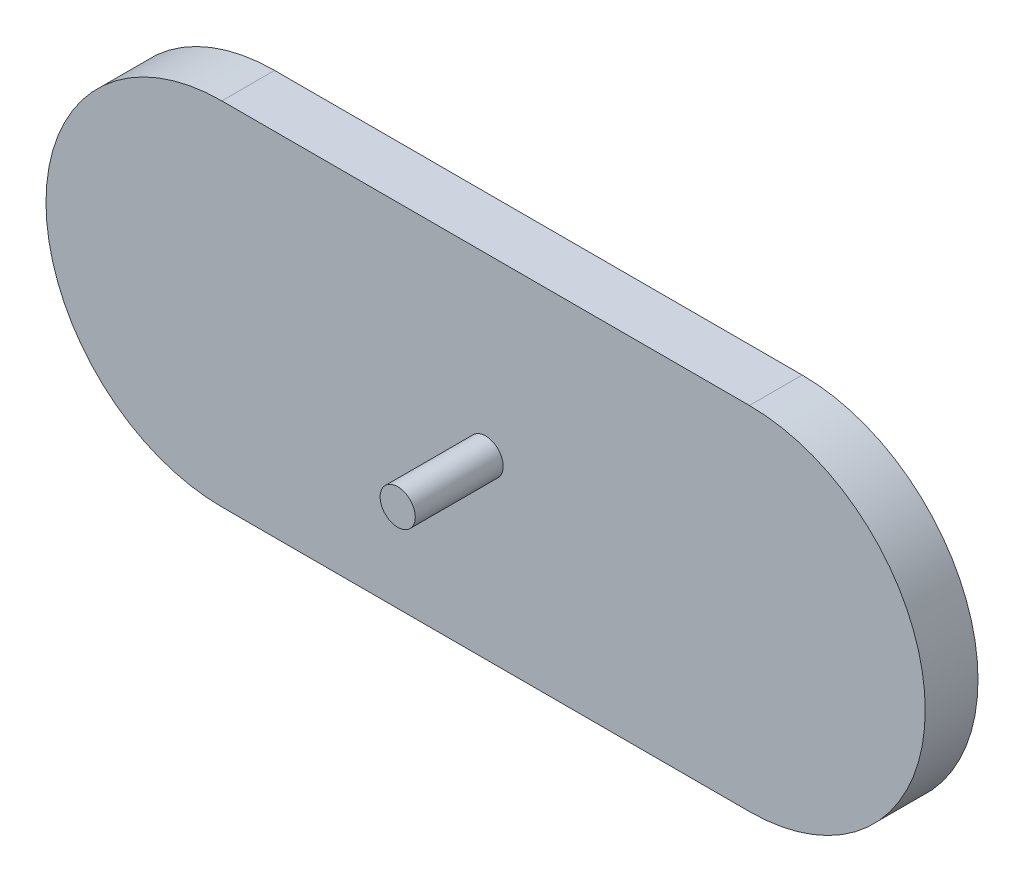
from build123d import *

# Parameters (mm, degrees)
SKETCH_1_W      = 150
SKETCH_1_H      = 100
EXTRUDE_1_DEPTH = 15
EXTRUDE_4_DEPTH = 15
SKETCH_1_13_R   = 5
EXTRUDE_5_DEPTH = 40


with BuildPart() as part:
    # 草图1 → 凸台-拉伸1 (new body)
    with BuildSketch(Plane.XY):
        with Locations((-75, 50)):
            Rectangle(SKETCH_1_W, SKETCH_1_H)
    extrude(amount=EXTRUDE_1_DEPTH)

    # 草图1<10> → 凸台-拉伸4 (add)
    with BuildSketch(Plane.XY):
        with BuildLine():
            ThreePointArc((-150, 100), (-200, 50), (-150, 0))
            Line((-150, 0), (-150, 100))
        make_face()
        with BuildLine():
            Line((0, 100), (0, 0))
            ThreePointArc((0, 0), (50, 50), (0, 100))
        make_face()
    extrude(amount=EXTRUDE_4_DEPTH)

    # 草图1<13> → 凸台-拉伸5 (add)
    with BuildSketch(Plane.XY):
        with Locations((-75, 50)):
            Circle(SKETCH_1_13_R)
    extrude(amount=EXTRUDE_5_DEPTH)


solid = part.part
